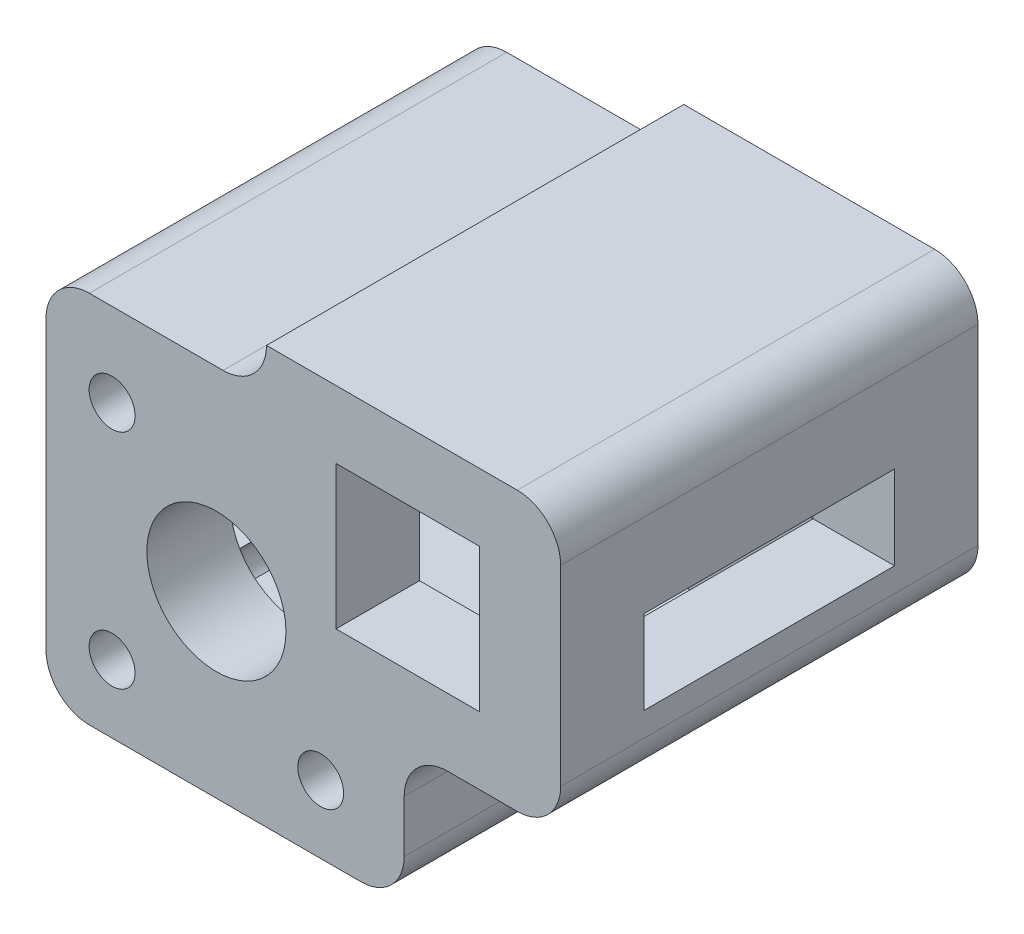
from build123d import *

# Parameters (mm, degrees)
SKETCH_1_W          = 37
SKETCH_1_H          = 30
SKETCH_1_W_2        = 10.3
SKETCH_1_H_2        = 10.3
EXTRUDE_1_DEPTH     = 30
SKETCH_2_R          = 1.65
SKETCH_2_W          = 11.25
SKETCH_2_H          = 10
CUT_EXTRUDE_1_DEPTH = 39.304699451
SKETCH_3_R          = 5
SKETCH_3_W          = 15.85
SKETCH_3_H          = 3.119518618
CUT_EXTRUDE_2_DEPTH = 39.304699451
SKETCH_4_W          = 18
SKETCH_4_H          = 14.880481382
CUT_EXTRUDE_3_DEPTH = 50.939963957
SKETCH_5_W          = 5.85
SKETCH_5_H          = 4.85
EXTRUDE_2_DEPTH     = 18
FILLET_2_R          = 3.12


with BuildPart() as part:
    # 草图1 → 凸台-拉伸1 (new body)
    with BuildSketch(Plane.XY):
        Rectangle(SKETCH_1_W, SKETCH_1_H)
        with Locations((7.5, 5)):
            Rectangle(SKETCH_1_W_2, SKETCH_1_H_2, mode=Mode.SUBTRACT)
    extrude(amount=EXTRUDE_1_DEPTH)

    # 草图2 → 切除-拉伸1 (cut, through all)
    with BuildSketch(Plane.XY.offset(30)):
        with Locations((-13.75, 5.880481382)):
            Circle(SKETCH_2_R)
        with Locations((-13.75, -10.119518618)):
            Circle(SKETCH_2_R)
        with Locations((1.25, -10.119518618)):
            Circle(SKETCH_2_R)
        with Locations((12.875, -10)):
            Rectangle(SKETCH_2_W, SKETCH_2_H)
    extrude(amount=-CUT_EXTRUDE_1_DEPTH, mode=Mode.SUBTRACT)

    # 草图3 → 切除-拉伸2 (cut, through all)
    with BuildSketch(Plane.XY.offset(30)):
        with Locations((-6.25, -2.119518618)):
            Circle(SKETCH_3_R)
        with Locations((-10.575, 13.440240691)):
            Rectangle(SKETCH_3_W, SKETCH_3_H)
    extrude(amount=-CUT_EXTRUDE_2_DEPTH, mode=Mode.SUBTRACT)

    # 草图4 → 切除-拉伸3 (cut, through all)
    with BuildSketch(Plane.ZY.offset(18.5)):
        with Locations((15, -1.559759309)):
            Rectangle(SKETCH_4_W, SKETCH_4_H)
    extrude(amount=-CUT_EXTRUDE_3_DEPTH, mode=Mode.SUBTRACT)

    # 草图5 → 凸台-拉伸2 (add)
    with BuildSketch(Plane.XY.offset(6)):
        with Locations((15.575, -2.575)):
            Rectangle(SKETCH_5_W, SKETCH_5_H)
    extrude(amount=EXTRUDE_2_DEPTH)

    # 圆角2
    # the kernel refuses this fillet: 3.12 mm, written as the material it adds along each edge
    with BuildSketch(Plane(origin=(7.25, -5, 6), x_dir=(0, -1, 0), z_dir=(0, 0, -1)), Plane(origin=(7.25, -5, 30), x_dir=(0, -1, 0), z_dir=(0, 0, -1))) as fillet_2_piece_1:
        with BuildLine():
            CenterArc((FILLET_2_R, -FILLET_2_R), FILLET_2_R, 90, 90)
            Line((0, -FILLET_2_R), (-FILLET_2_R * 0.02, -FILLET_2_R))
            Line((-FILLET_2_R * 0.02, -FILLET_2_R), (-FILLET_2_R * 0.02, FILLET_2_R * 0.02))
            Line((-FILLET_2_R * 0.02, FILLET_2_R * 0.02), (FILLET_2_R, FILLET_2_R * 0.02))
            Line((FILLET_2_R, FILLET_2_R * 0.02), (FILLET_2_R, 0))
        make_face()
    extrude(amount=6)
    with BuildSketch(Plane(origin=(-2.65, 11.880481382, 30), x_dir=(0, 1, 0), z_dir=(0, 0, -1))) as fillet_2_piece_2:
        with BuildLine():
            CenterArc((FILLET_2_R, -FILLET_2_R), FILLET_2_R, 90, 90)
            Line((0, -FILLET_2_R), (-FILLET_2_R * 0.02, -FILLET_2_R))
            Line((-FILLET_2_R * 0.02, -FILLET_2_R), (-FILLET_2_R * 0.02, FILLET_2_R * 0.02))
            Line((-FILLET_2_R * 0.02, FILLET_2_R * 0.02), (FILLET_2_R, FILLET_2_R * 0.02))
            Line((FILLET_2_R, FILLET_2_R * 0.02), (FILLET_2_R, 0))
        make_face()
    extrude(amount=30)
    # the kernel refuses this fillet: 3.12 mm, written as the material it takes off along each edge
    with BuildSketch(Plane(origin=(-18.5, 11.880481382, 30), x_dir=(1, 0, 0), z_dir=(0, 0, -1)), Plane(origin=(18.5, -5, 30), x_dir=(-1, 0, 0), z_dir=(0, 0, -1)), Plane(origin=(7.25, -15, 30), x_dir=(-1, 0, 0), z_dir=(0, 0, -1))) as fillet_2_2_piece_1:
        with BuildLine():
            CenterArc((FILLET_2_R, FILLET_2_R), FILLET_2_R, 180, 90)
            Line((0, FILLET_2_R), (-FILLET_2_R * 0.02, FILLET_2_R))
            Line((-FILLET_2_R * 0.02, FILLET_2_R), (-FILLET_2_R * 0.02, -FILLET_2_R * 0.02))
            Line((-FILLET_2_R * 0.02, -FILLET_2_R * 0.02), (FILLET_2_R, -FILLET_2_R * 0.02))
            Line((FILLET_2_R, -FILLET_2_R * 0.02), (FILLET_2_R, 0))
        make_face()
    extrude(amount=30, mode=Mode.SUBTRACT)
    with BuildSketch(Plane(origin=(18.5, 15, 0), x_dir=(0, -1, 0), z_dir=(0, 0, 1)), Plane(origin=(-18.5, -15, 0), x_dir=(0, 1, 0), z_dir=(0, 0, 1))) as fillet_2_2_piece_2:
        with BuildLine():
            CenterArc((FILLET_2_R, -FILLET_2_R), FILLET_2_R, 90, 90)
            Line((0, -FILLET_2_R), (-FILLET_2_R * 0.02, -FILLET_2_R))
            Line((-FILLET_2_R * 0.02, -FILLET_2_R), (-FILLET_2_R * 0.02, FILLET_2_R * 0.02))
            Line((-FILLET_2_R * 0.02, FILLET_2_R * 0.02), (FILLET_2_R, FILLET_2_R * 0.02))
            Line((FILLET_2_R, FILLET_2_R * 0.02), (FILLET_2_R, 0))
        make_face()
    extrude(amount=30, mode=Mode.SUBTRACT)


solid = part.part
